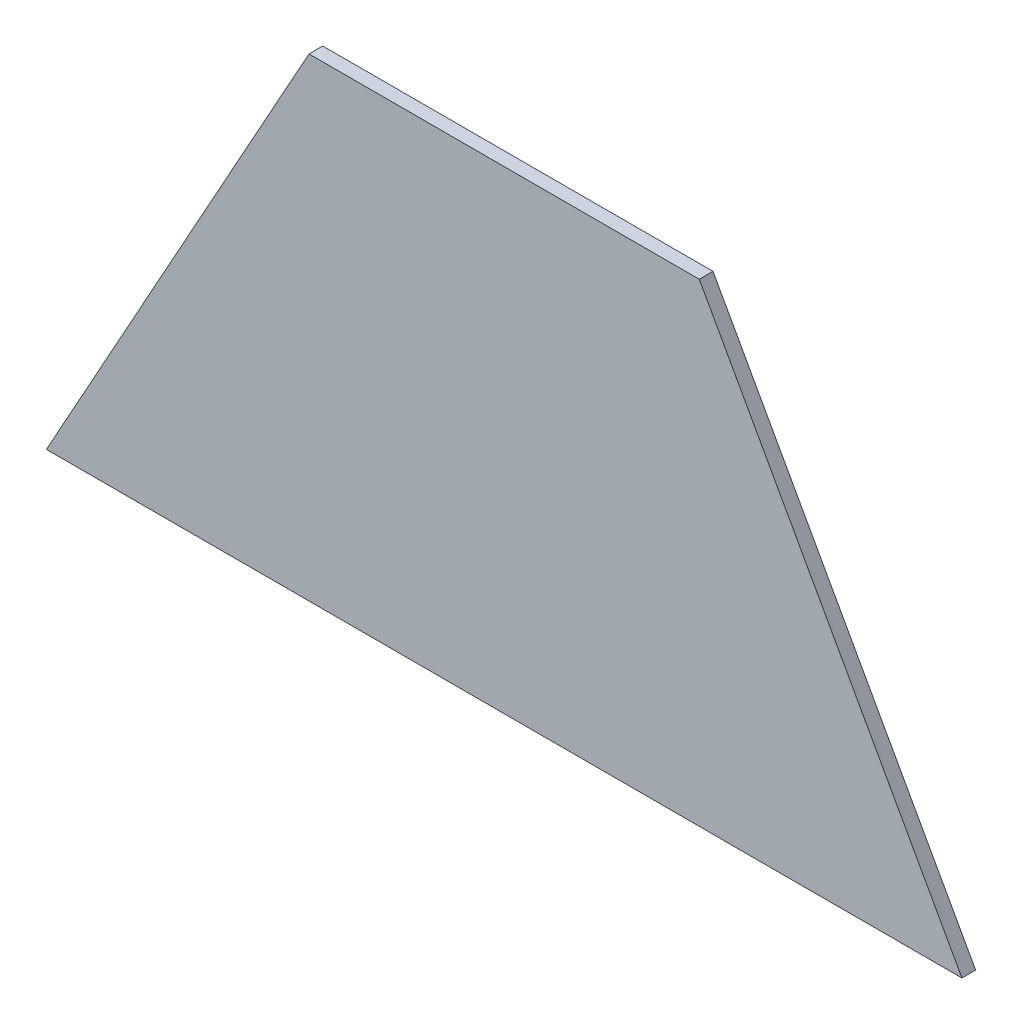
from build123d import *

# Parameters (mm, degrees)
BOSS_EXTRUDE1_DEPTH = 18.25625


with BuildPart() as part:
    # Sketch1 → Boss-Extrude1 (new body)
    with BuildSketch(Plane.XY):
        Polygon((-592.868514419, -14.231906615), (626.331485581, -14.231906615), (276.591375832, 616.715953307), (-243.128404669, 616.715953307), align=None)
    extrude(amount=BOSS_EXTRUDE1_DEPTH)


solid = part.part
